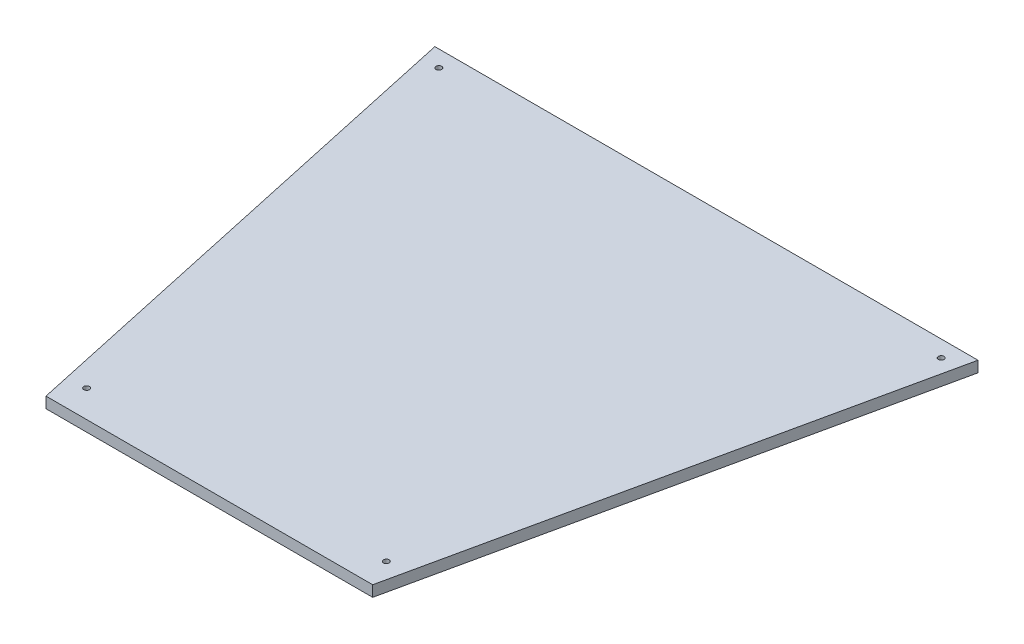
from build123d import *

# Parameters (mm, degrees)
BOSS_EXTRUDE1_DEPTH = 12.7
SKETCH2_R           = 3.2639
CUT_EXTRUDE1_DEPTH  = 695.226396558


with BuildPart() as part:
    # Sketch1 → Boss-Extrude1 (new body)
    with BuildSketch(Plane(origin=(4.555990946, 0, 422.877296058), x_dir=(-0.9999999994755782, 0, 3.2385856298737384e-05), z_dir=(0, -1, 0))):
        Polygon((-184.891152981, -195.663474972), (194.015807939, -195.651203746), (319.509878582, 380.901443858), (-310.422567663, 380.881042957), align=None)
    extrude(amount=BOSS_EXTRUDE1_DEPTH)

    # Sketch2 → Cut-Extrude1 (cut, through all)
    with BuildSketch(Plane(origin=(0, 0, 0), x_dir=(0.9999999994755782, 0, -3.238585631339118e-05), z_dir=(0, 1, 0))):
        with Locations((-173.997228013, -586.878757708)):
            Circle(SKETCH2_R)
        with Locations((173.892647149, -587.193692915)):
            Circle(SKETCH2_R)
        with Locations((291.320911655, -61.056515355)):
            Circle(SKETCH2_R)
        with Locations((-291.324865779, -61.037645873)):
            Circle(SKETCH2_R)
    extrude(amount=-CUT_EXTRUDE1_DEPTH, mode=Mode.SUBTRACT)


solid = part.part
